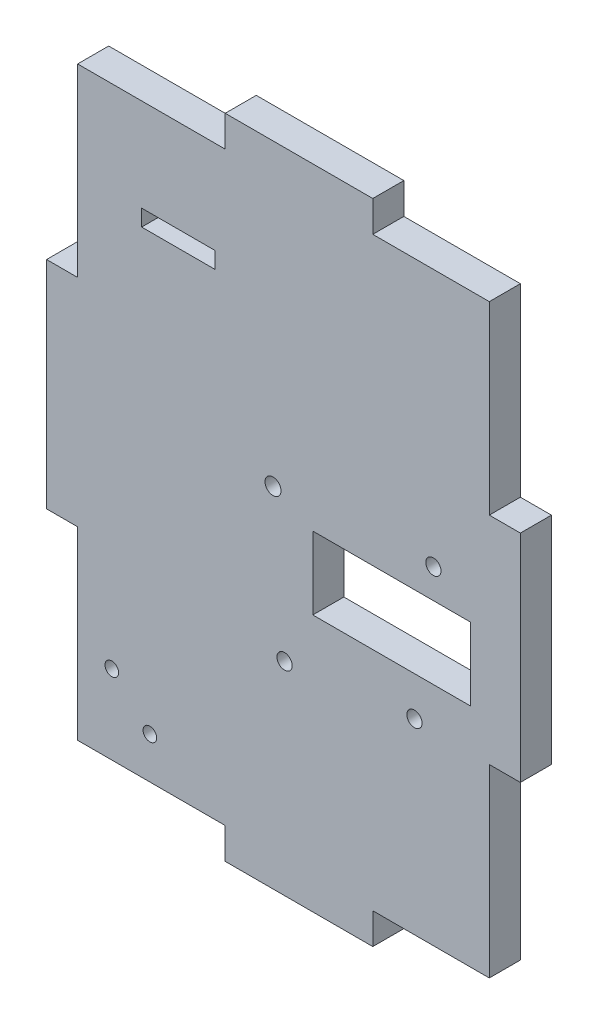
from build123d import *

# Parameters (mm, degrees)
SKETCH1_W                = 88.3412
SKETCH1_H                = 120.8024
BOSS_EXTRUDE1_DEPTH      = 5.7912
SKETCH6_R                = 1.4224
SKETCH6_R_2              = 1.497641053
CUT_EXTRUDE5_DEPTH       = 76.052547347
SKETCH7_W                = 29.367351422
SKETCH7_H                = 13.544863044
CUT_EXTRUDE6_DEPTH       = 76.052547347
CAVITY1_START            = -60.4012
CAVITY1_OUTLINE_W        = 5.7912
CAVITY1_OUTLINE_H        = 5.7912
CAVITY1_DEPTH            = 40.267466667
CAVITY1_START_2          = 20.133733333
CAVITY1_2_OUTLINE_W      = 5.7912
CAVITY1_2_OUTLINE_H      = 5.7912
CAVITY1_2_DEPTH          = 40.267466667
CAVITY1_3_OUTLINE_W      = 21.725466667
CAVITY1_3_OUTLINE_H      = 5.7912
CAVITY1_3_OUTLINE_W_2    = 27.516666667
CAVITY1_3_DEPTH          = 5.7912
CAVITY1_START_3          = 54.61
CAVITY1_4_OUTLINE_W      = 21.725466667
CAVITY1_4_OUTLINE_H      = 5.7912
CAVITY1_4_OUTLINE_W_2    = 27.516666667
CAVITY1_4_DEPTH          = 5.7912
CUT_EXTRUDE13_DEPTH      = 22.352
CUT_EXTRUDE13_DEPTH_BACK = 32.512
SKETCH8_R                = 1.27
SKETCH9_W                = 13.671222204
SKETCH9_H                = 3.060294153
CUT_EXTRUDE14_DEPTH      = 76.052547347


# Read off the part's stored shape, not the designer's step: Cavity1
with BuildPart() as part:
    # Sketch1 → Boss-Extrude1 (new body)
    with BuildSketch(Plane.XY):
        Rectangle(SKETCH1_W, SKETCH1_H)
    extrude(amount=BOSS_EXTRUDE1_DEPTH)

    # Sketch6 → Cut-Extrude5 (cut, through all)
    with BuildSketch(Plane.XY.offset(5.7912)):
        with Locations((0.2032, -22.564194219)):
            Circle(SKETCH6_R)
        with Locations((24.423695828, -19.744653869)):
            Circle(SKETCH6_R)
        with Locations((-1.949450117, 4.630928051)):
            Circle(SKETCH6_R_2)
        with Locations((27.953664088, 6.598815085)):
            Circle(SKETCH6_R)
    extrude(amount=-CUT_EXTRUDE5_DEPTH, mode=Mode.SUBTRACT)

    # Sketch7 → Cut-Extrude6 (cut, through all)
    with BuildSketch(Plane(origin=(0, 0, 0), x_dir=(-1, 0, 0), z_dir=(0, 0, -1))):
        with Locations((-20.155118324, -5.666932702)):
            Rectangle(SKETCH7_W, SKETCH7_H)
    extrude(amount=-CUT_EXTRUDE6_DEPTH, mode=Mode.SUBTRACT)

    # Cavity1 outline → Cavity1 (cut)
    with BuildSketch(Plane(origin=(0, 0, 0), x_dir=(1, 0, 0), z_dir=(0, 1, 0)).offset(CAVITY1_START)):
        with Locations((41.275, -2.8956)):
            Rectangle(CAVITY1_OUTLINE_W, CAVITY1_OUTLINE_H)
        with Locations((-41.275, -2.8956)):
            Rectangle(CAVITY1_OUTLINE_W, CAVITY1_OUTLINE_H)
    extrude(amount=CAVITY1_DEPTH, mode=Mode.SUBTRACT)

    # Cavity1 2 outline → Cavity1 2 (cut)
    with BuildSketch(Plane(origin=(0, 0, 0), x_dir=(1, 0, 0), z_dir=(0, 1, 0)).offset(CAVITY1_START_2)):
        with Locations((41.275, -2.8956)):
            Rectangle(CAVITY1_2_OUTLINE_W, CAVITY1_2_OUTLINE_H)
        with Locations((-41.275, -2.8956)):
            Rectangle(CAVITY1_2_OUTLINE_W, CAVITY1_2_OUTLINE_H)
    extrude(amount=CAVITY1_2_DEPTH, mode=Mode.SUBTRACT)

    # Cavity1 3 outline → Cavity1 3 (cut)
    with BuildSketch(Plane(origin=(0, 0, 0), x_dir=(1, 0, 0), z_dir=(0, 1, 0)).offset(CAVITY1_START)):
        with Locations((27.516666667, -2.8956)):
            Rectangle(CAVITY1_3_OUTLINE_W, CAVITY1_3_OUTLINE_H)
        with Locations((-24.621066667, -2.8956)):
            Rectangle(CAVITY1_3_OUTLINE_W_2, CAVITY1_3_OUTLINE_H)
    extrude(amount=CAVITY1_3_DEPTH, mode=Mode.SUBTRACT)

    # Cavity1 4 outline → Cavity1 4 (cut)
    with BuildSketch(Plane(origin=(0, 0, 0), x_dir=(1, 0, 0), z_dir=(0, 1, 0)).offset(CAVITY1_START_3)):
        with Locations((27.516666667, -2.8956)):
            Rectangle(CAVITY1_4_OUTLINE_W, CAVITY1_4_OUTLINE_H)
        with Locations((-24.621066667, -2.8956)):
            Rectangle(CAVITY1_4_OUTLINE_W_2, CAVITY1_4_OUTLINE_H)
    extrude(amount=CAVITY1_4_DEPTH, mode=Mode.SUBTRACT)

    # Sketch8 → Cut-Extrude13 (cut, two sides: drawn at the far end of the back side and taken through both)
    with BuildSketch(Plane.XY.offset(-CUT_EXTRUDE13_DEPTH_BACK)):
        with Locations(Location((-24.91218753, -46.860591388, 0), (0, 0, 180))):
            Circle(SKETCH8_R)
        with Locations(Location((-32.009882617, -39.878782893, 0), (0, 0, 180))):
            Circle(SKETCH8_R)
    extrude(amount=CUT_EXTRUDE13_DEPTH + CUT_EXTRUDE13_DEPTH_BACK, mode=Mode.SUBTRACT)

    # Sketch9 → Cut-Extrude14 (cut, through all)
    with BuildSketch(Plane.XY.offset(5.7912)):
        with Locations((-19.603898062, 35.76912754)):
            Rectangle(SKETCH9_W, SKETCH9_H)
    extrude(amount=-CUT_EXTRUDE14_DEPTH, mode=Mode.SUBTRACT)


solid = part.part
